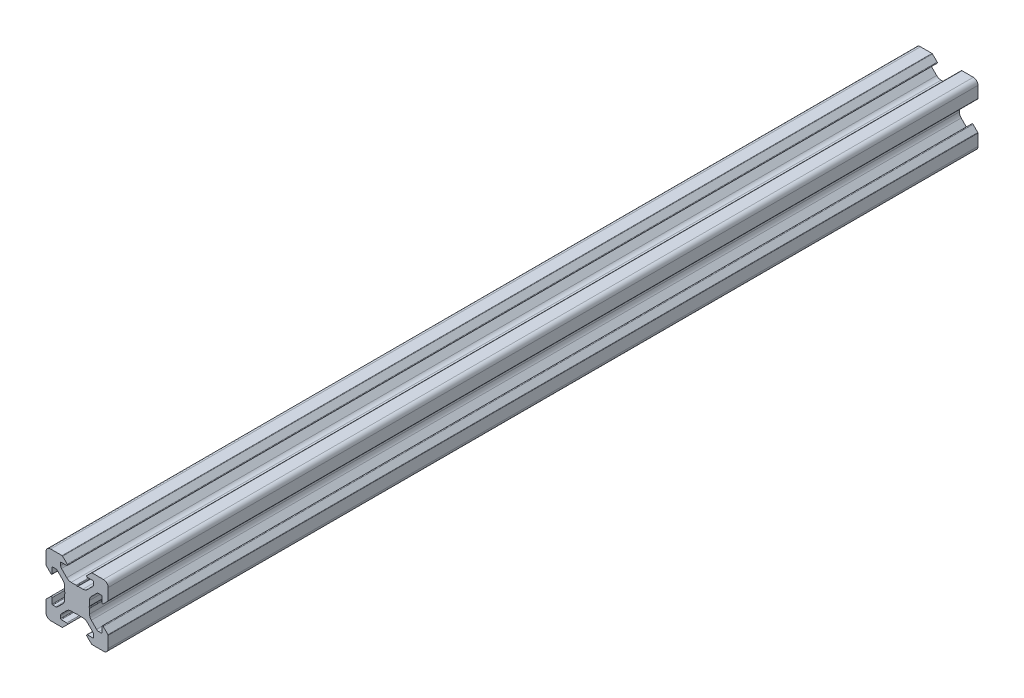
from build123d import *

# Parameters (mm, degrees)
EXTRUDE_1_DEPTH = 280


# Read off the part's stored shape, not the designer's step: 222 Конструкционный профиль 20х20-1-surface1
with BuildPart() as part:
    # Эскиз1 → Бобышка-Вытянуть1 (new body)
    with BuildSketch(Plane.XY):
        with BuildLine():
            Line((-3.945217202, 0.181521503), (-3.8, 0))
            Line((-3.8, 0), (-3.945217202, -0.181521503))
            ThreePointArc((-3.945217202, -0.181521503), (-3.98590708, -0.254943529), (-4, -0.337695265))
            Line((-4, -0.337695265), (-4, -1.898780669))
            ThreePointArc((-4, -1.898780669), (-4.152240935, -2.664147534), (-4.585786438, -3.312994231))
            Line((-4.585786438, -3.312994231), (-6.279898987, -5.007106781))
            ThreePointArc((-6.279898987, -5.007106781), (-6.604322336, -5.223879533), (-6.987005769, -5.3))
            Line((-6.987005769, -5.3), (-7.8, -5.3))
            ThreePointArc((-7.8, -5.3), (-7.941421356, -5.241421356), (-8, -5.1))
            Line((-8, -5.1), (-8, -3.33))
            ThreePointArc((-8, -3.33), (-8.154329142, -3.099030117), (-8.426776695, -3.153223305))
            Line((-8.426776695, -3.153223305), (-9.926776695, -4.653223305))
            ThreePointArc((-9.926776695, -4.653223305), (-9.980969883, -4.734329142), (-10, -4.83))
            Line((-10, -4.83), (-10, -8.5))
            ThreePointArc((-10, -8.5), (-9.560660172, -9.560660172), (-8.5, -10))
            Line((-8.5, -10), (-4.83, -10))
            ThreePointArc((-4.83, -10), (-4.734329142, -9.980969883), (-4.653223305, -9.926776695))
            Line((-4.653223305, -9.926776695), (-3.153223305, -8.426776695))
            ThreePointArc((-3.153223305, -8.426776695), (-3.099030117, -8.154329142), (-3.33, -8))
            Line((-3.33, -8), (-5.1, -8))
            ThreePointArc((-5.1, -8), (-5.241421356, -7.941421356), (-5.3, -7.8))
            Line((-5.3, -7.8), (-5.3, -6.987005769))
            ThreePointArc((-5.3, -6.987005769), (-5.223879533, -6.604322336), (-5.007106781, -6.279898987))
            Line((-5.007106781, -6.279898987), (-3.312994231, -4.585786438))
            ThreePointArc((-3.312994231, -4.585786438), (-2.664147534, -4.152240935), (-1.898780669, -4))
            Line((-1.898780669, -4), (-0.337695265, -4))
            ThreePointArc((-0.337695265, -4), (-0.254943529, -3.98590708), (-0.181521503, -3.945217202))
            Line((-0.181521503, -3.945217202), (0, -3.8))
            Line((0, -3.8), (0.181521503, -3.945217202))
            ThreePointArc((0.181521503, -3.945217202), (0.254943529, -3.98590708), (0.337695265, -4))
            Line((0.337695265, -4), (1.898780669, -4))
            ThreePointArc((1.898780669, -4), (2.664147534, -4.152240935), (3.312994231, -4.585786438))
            Line((3.312994231, -4.585786438), (5.007106781, -6.279898987))
            ThreePointArc((5.007106781, -6.279898987), (5.223879533, -6.604322336), (5.3, -6.987005769))
            Line((5.3, -6.987005769), (5.3, -7.8))
            ThreePointArc((5.3, -7.8), (5.241421356, -7.941421356), (5.1, -8))
            Line((5.1, -8), (3.33, -8))
            ThreePointArc((3.33, -8), (3.099030117, -8.154329142), (3.153223305, -8.426776695))
            Line((3.153223305, -8.426776695), (4.653223305, -9.926776695))
            ThreePointArc((4.653223305, -9.926776695), (4.734329142, -9.980969883), (4.83, -10))
            Line((4.83, -10), (8.5, -10))
            ThreePointArc((8.5, -10), (9.560660172, -9.560660172), (10, -8.5))
            Line((10, -8.5), (10, -4.83))
            ThreePointArc((10, -4.83), (9.980969883, -4.734329142), (9.926776695, -4.653223305))
            Line((9.926776695, -4.653223305), (8.426776695, -3.153223305))
            ThreePointArc((8.426776695, -3.153223305), (8.154329142, -3.099030117), (8, -3.33))
            Line((8, -3.33), (8, -5.1))
            ThreePointArc((8, -5.1), (7.941421356, -5.241421356), (7.8, -5.3))
            Line((7.8, -5.3), (6.987005769, -5.3))
            ThreePointArc((6.987005769, -5.3), (6.604322336, -5.223879533), (6.279898987, -5.007106781))
            Line((6.279898987, -5.007106781), (4.585786438, -3.312994231))
            ThreePointArc((4.585786438, -3.312994231), (4.152240935, -2.664147534), (4, -1.898780669))
            Line((4, -1.898780669), (4, -0.337695265))
            ThreePointArc((4, -0.337695265), (3.98590708, -0.254943529), (3.945217202, -0.181521503))
            Line((3.945217202, -0.181521503), (3.8, 0))
            Line((3.8, 0), (3.945217202, 0.181521503))
            ThreePointArc((3.945217202, 0.181521503), (3.98590708, 0.254943529), (4, 0.337695265))
            Line((4, 0.337695265), (4, 1.898780669))
            ThreePointArc((4, 1.898780669), (4.152240935, 2.664147534), (4.585786438, 3.312994231))
            Line((4.585786438, 3.312994231), (6.279898987, 5.007106781))
            ThreePointArc((6.279898987, 5.007106781), (6.604322336, 5.223879533), (6.987005769, 5.3))
            Line((6.987005769, 5.3), (7.8, 5.3))
            ThreePointArc((7.8, 5.3), (7.941421356, 5.241421356), (8, 5.1))
            Line((8, 5.1), (8, 3.33))
            ThreePointArc((8, 3.33), (8.154329142, 3.099030117), (8.426776695, 3.153223305))
            Line((8.426776695, 3.153223305), (9.926776695, 4.653223305))
            ThreePointArc((9.926776695, 4.653223305), (9.980969883, 4.734329142), (10, 4.83))
            Line((10, 4.83), (10, 8.5))
            ThreePointArc((10, 8.5), (9.560660172, 9.560660172), (8.5, 10))
            Line((8.5, 10), (4.83, 10))
            ThreePointArc((4.83, 10), (4.734329142, 9.980969883), (4.653223305, 9.926776695))
            Line((4.653223305, 9.926776695), (3.153223305, 8.426776695))
            ThreePointArc((3.153223305, 8.426776695), (3.099030117, 8.154329142), (3.33, 8))
            Line((3.33, 8), (5.1, 8))
            ThreePointArc((5.1, 8), (5.241421356, 7.941421356), (5.3, 7.8))
            Line((5.3, 7.8), (5.3, 6.987005769))
            ThreePointArc((5.3, 6.987005769), (5.223879533, 6.604322336), (5.007106781, 6.279898987))
            Line((5.007106781, 6.279898987), (3.312994231, 4.585786438))
            ThreePointArc((3.312994231, 4.585786438), (2.664147534, 4.152240935), (1.898780669, 4))
            Line((1.898780669, 4), (0.337695265, 4))
            ThreePointArc((0.337695265, 4), (0.254943529, 3.98590708), (0.181521503, 3.945217202))
            Line((0.181521503, 3.945217202), (0, 3.8))
            Line((0, 3.8), (-0.181521503, 3.945217202))
            ThreePointArc((-0.181521503, 3.945217202), (-0.254943529, 3.98590708), (-0.337695265, 4))
            Line((-0.337695265, 4), (-1.898780669, 4))
            ThreePointArc((-1.898780669, 4), (-2.664147534, 4.152240935), (-3.312994231, 4.585786438))
            Line((-3.312994231, 4.585786438), (-5.007106781, 6.279898987))
            ThreePointArc((-5.007106781, 6.279898987), (-5.223879533, 6.604322336), (-5.3, 6.987005769))
            Line((-5.3, 6.987005769), (-5.3, 7.8))
            ThreePointArc((-5.3, 7.8), (-5.241421356, 7.941421356), (-5.1, 8))
            Line((-5.1, 8), (-3.33, 8))
            ThreePointArc((-3.33, 8), (-3.099030117, 8.154329142), (-3.153223305, 8.426776695))
            Line((-3.153223305, 8.426776695), (-4.653223305, 9.926776695))
            ThreePointArc((-4.653223305, 9.926776695), (-4.734329142, 9.980969883), (-4.83, 10))
            Line((-4.83, 10), (-8.5, 10))
            ThreePointArc((-8.5, 10), (-9.560660172, 9.560660172), (-10, 8.5))
            Line((-10, 8.5), (-10, 4.83))
            ThreePointArc((-10, 4.83), (-9.980969883, 4.734329142), (-9.926776695, 4.653223305))
            Line((-9.926776695, 4.653223305), (-8.426776695, 3.153223305))
            ThreePointArc((-8.426776695, 3.153223305), (-8.154329142, 3.099030117), (-8, 3.33))
            Line((-8, 3.33), (-8, 5.1))
            ThreePointArc((-8, 5.1), (-7.941421356, 5.241421356), (-7.8, 5.3))
            Line((-7.8, 5.3), (-6.987005769, 5.3))
            ThreePointArc((-6.987005769, 5.3), (-6.604322336, 5.223879533), (-6.279898987, 5.007106781))
            Line((-6.279898987, 5.007106781), (-4.585786438, 3.312994231))
            ThreePointArc((-4.585786438, 3.312994231), (-4.152240935, 2.664147534), (-4, 1.898780669))
            Line((-4, 1.898780669), (-4, 0.337695265))
            ThreePointArc((-4, 0.337695265), (-3.98590708, 0.254943529), (-3.945217202, 0.181521503))
        make_face()
    extrude(amount=EXTRUDE_1_DEPTH)


solid = part.part
